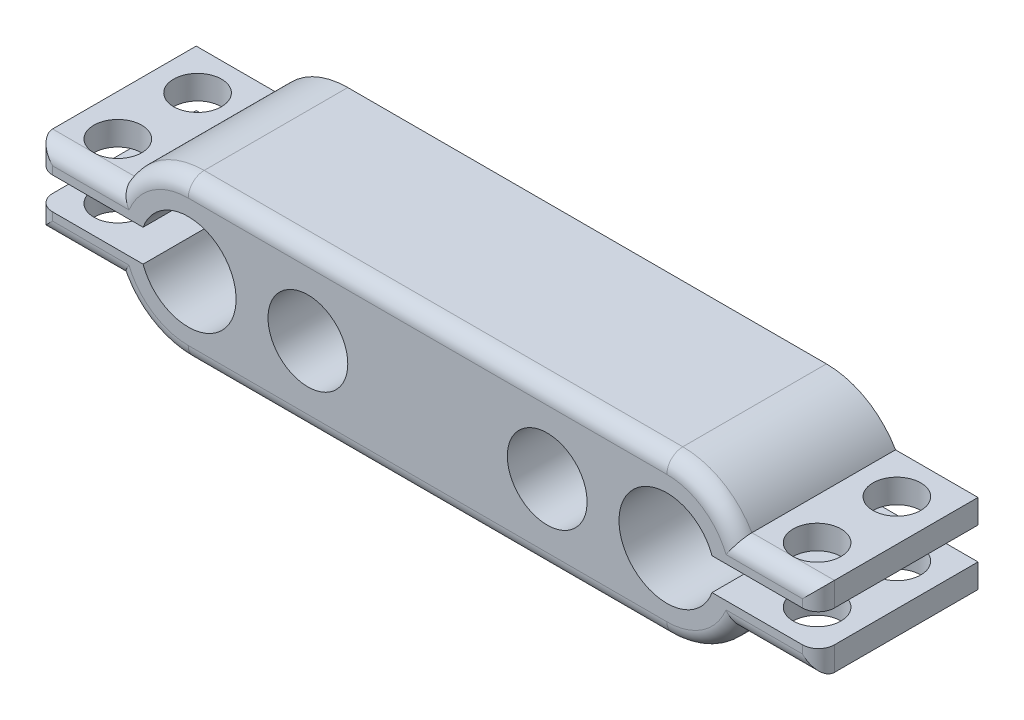
from build123d import *

# Parameters (mm, degrees)
SKETCH_1_W          = 49
SKETCH_1_H          = 12
SKETCH_1_R          = 3
SKETCH_1_R_2        = 2.5
EXTRUDE_1_DEPTH     = 10
CUT_EXTRUDE_1_DEPTH = 28.133927102
SKETCH_3_R          = 1.5
CUT_EXTRUDE_2_DEPTH = 29.28869032
FILLET_1_R          = 1


with BuildPart() as part:
    # 스케치1 → 보스-돌출1 (new body)
    with BuildSketch(Plane.XY):
        Rectangle(SKETCH_1_W, SKETCH_1_H)
        with Locations((-15, 0)):
            Circle(SKETCH_1_R, mode=Mode.SUBTRACT)
        with Locations(Location((15, 0, 0), (0, 0, 180))):
            Circle(SKETCH_1_R, mode=Mode.SUBTRACT)
        with Locations((-7.5, 0)):
            Circle(SKETCH_1_R_2, mode=Mode.SUBTRACT)
        with Locations(Location((7.5, 0, 0), (0, 0, 180))):
            Circle(SKETCH_1_R_2, mode=Mode.SUBTRACT)
    extrude(amount=EXTRUDE_1_DEPTH)

    # 스케치2 → 컷-돌출1 (cut, through all)
    with BuildSketch(Plane.XY.offset(10)):
        with BuildLine():
            ThreePointArc((-19.330127019, 2.5), (-17.5, 4.330127019), (-15, 5))
            Line((-15, 5), (15, 5))
            ThreePointArc((15, 5), (17.5, 4.330127019), (19.330127019, 2.5))
            Line((19.330127019, 2.5), (24.5, 2.5))
            Line((24.5, 2.5), (24.5, 6))
            Line((24.5, 6), (-24.5, 6))
            Line((-24.5, 6), (-24.5, 2.5))
            Line((-24.5, 2.5), (-19.330127019, 2.5))
        make_face()
        with BuildLine():
            ThreePointArc((-15, -5), (-17.5, -4.330127019), (-19.330127019, -2.5))
            Line((-19.330127019, -2.5), (-24.5, -2.5))
            Line((-24.5, -2.5), (-24.5, -6))
            Line((-24.5, -6), (24.5, -6))
            Line((24.5, -6), (24.5, -2.5))
            Line((24.5, -2.5), (19.330127019, -2.5))
            ThreePointArc((19.330127019, -2.5), (17.5, -4.330127019), (15, -5))
            Line((15, -5), (-15, -5))
        make_face()
        with BuildLine():
            ThreePointArc((-19.898979486, -1), (-20, 0), (-19.898979486, 1))
            Line((-19.898979486, 1), (-24.5, 1))
            Line((-24.5, 1), (-24.5, -1))
            Line((-24.5, -1), (-19.898979486, -1))
        make_face()
        with BuildLine():
            Line((24.5, 1), (19.898979486, 1))
            ThreePointArc((19.898979486, 1), (20, 0), (19.898979486, -1))
            Line((19.898979486, -1), (24.5, -1))
            Line((24.5, -1), (24.5, 1))
        make_face()
        with BuildLine():
            Line((-17.828427125, 1), (-19.898979486, 1))
            ThreePointArc((-19.898979486, 1), (-20, 0), (-19.898979486, -1))
            Line((-19.898979486, -1), (-17.828427125, -1))
            ThreePointArc((-17.828427125, -1), (-18, 0), (-17.828427125, 1))
        make_face()
        with BuildLine():
            ThreePointArc((19.898979486, -1), (20, 0), (19.898979486, 1))
            Line((19.898979486, 1), (17.828427125, 1))
            ThreePointArc((17.828427125, 1), (17.956795679, 0.507305936), (18, 0))
            ThreePointArc((18, 0), (17.956795679, -0.507305936), (17.828427125, -1))
            Line((17.828427125, -1), (19.898979486, -1))
        make_face()
    extrude(amount=-CUT_EXTRUDE_1_DEPTH, mode=Mode.SUBTRACT)

    # 스케치3 → 컷-돌출2 (cut, through all)
    with BuildSketch(Plane(origin=(0, 5, 0), x_dir=(1, 0, 0), z_dir=(0, 1, 0))):
        with Locations((-21.915063509, -2.5)):
            Circle(SKETCH_3_R)
        with Locations((-21.915063509, -7.5)):
            Circle(SKETCH_3_R)
        with Locations(Location((21.915063509, -7.5, 0), (0, 0, 270))):
            Circle(SKETCH_3_R)
        with Locations(Location((21.915063509, -2.5, 0), (0, 0, 270))):
            Circle(SKETCH_3_R)
    extrude(amount=-CUT_EXTRUDE_2_DEPTH, mode=Mode.SUBTRACT)

    # 필렛1
    fillet_1_edges = [part.edges().sort_by_distance(p)[0] for p in [
        (-24.5, 1.75, 10),
        (17.5, 4.330127019, 10),
        (-17.5, 4.330127019, 10),
        (21.915063509, 2.5, 10),
        (-21.915063509, 2.5, 10),
        (0, 5, 10),
        (24.5, -1.75, 10),
        (17.5, -4.330127019, 10),
        (-21.915063509, -2.5, 10),
        (-17.5, -4.330127019, 10),
        (0, -5, 10),
        (21.915063509, -2.5, 10),
        (-24.5, -1.75, 10),
        (24.5, 1.75, 10),
    ]]
    fillet(fillet_1_edges, radius=FILLET_1_R - 0.0001)  # a hair under: the kernel refuses the full size


solid = part.part
